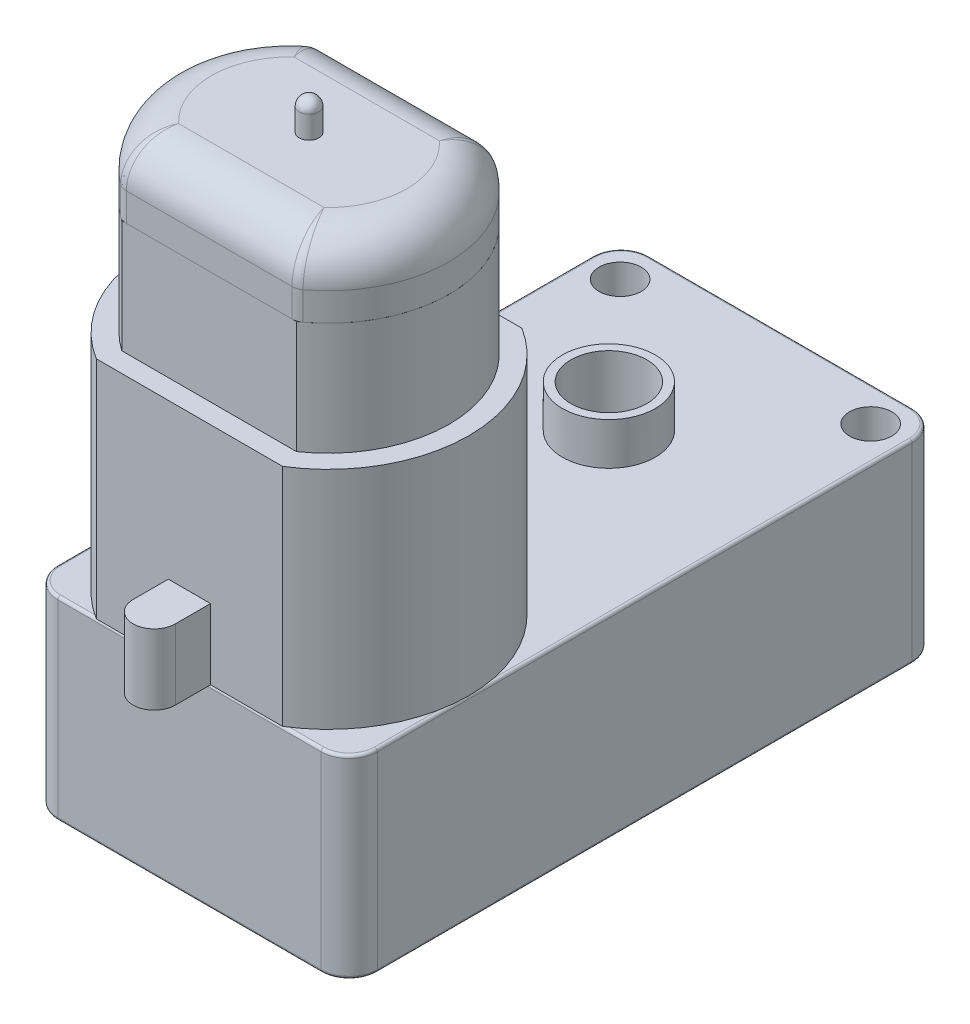
from build123d import *

# Parameters (mm, degrees)
SKETCH1_W           = 22.7
SKETCH1_H           = 42
BOSS_EXTRUDE1_DEPTH = 13.8
BOSS_EXTRUDE2_DEPTH = 16
SKETCH3_R           = 2.7
CUT_EXTRUDE1_DEPTH  = 39.181965638
FILLET1_R           = 2
FILLET2_R           = 0.2
SKETCH4_R           = 1.5
CUT_EXTRUDE2_DEPTH  = 39.181965638
SKETCH5_R           = 3.3
SKETCH5_R_2         = 2.7
BOSS_EXTRUDE3_DEPTH = 3
BOSS_EXTRUDE4_DEPTH = 5
BOSS_EXTRUDE5_DEPTH = 8
BOSS_EXTRUDE6_DEPTH = 5
FILLET3_R           = 3
FILLET4_R           = 1
SKETCH10_R          = 2
BOSS_EXTRUDE7_DEPTH = 2


with BuildPart() as part:
    # Sketch1 → Boss-Extrude1 (new body)
    with BuildSketch(Plane(origin=(0, 0, 0), x_dir=(1, 0, 0), z_dir=(0, 1, 0))):
        Rectangle(SKETCH1_W, SKETCH1_H)
    extrude(amount=BOSS_EXTRUDE1_DEPTH)

    # Sketch3 → Cut-Extrude1 (cut, through all)
    with BuildSketch(Plane.XZ):
        with Locations(Location((0, -8.8, 0), (0, 0, 270))):
            Circle(SKETCH3_R)
    extrude(amount=-CUT_EXTRUDE1_DEPTH, mode=Mode.SUBTRACT)

    # Fillet1
    fillet1_edges = [part.edges().sort_by_distance(p)[0] for p in [
        (11.35, 6.9, 21),
        (-11.35, 6.9, 21),
        (-11.35, 6.9, -21),
        (11.35, 6.9, -21),
    ]]
    fillet(fillet1_edges, radius=FILLET1_R)

    # Fillet2
    fillet2_edges = [part.edges().sort_by_distance(p)[0] for p in [
        (-11.35, 0, 0),
        (-11.35, 13.8, 0),
        (11.35, 0, 0),
        (0, 0, 21),
        (0, 0, -21),
        (10.764213562, 0, -20.414213562),
        (10.764213562, 0, 20.414213562),
        (-10.764213562, 0, 20.414213562),
        (-10.764213562, 0, -20.414213562),
        (0, 13.8, -21),
        (11.35, 13.8, 0),
        (0, 13.8, 21),
        (10.764213562, 13.8, -20.414213562),
        (10.764213562, 13.8, 20.414213562),
        (-10.764213562, 13.8, 20.414213562),
        (-10.764213562, 13.8, -20.414213562),
    ]]
    fillet(fillet2_edges, radius=FILLET2_R)

    # Sketch4 → Cut-Extrude2 (cut, through all)
    with BuildSketch(Plane.XZ):
        with Locations(Location((-8.9, -18.5, 0), (0, 0, 270))):
            Circle(SKETCH4_R)
        with Locations(Location((8.9, -18.5, 0), (0, 0, 270))):
            Circle(SKETCH4_R)
    extrude(amount=-CUT_EXTRUDE2_DEPTH, mode=Mode.SUBTRACT)

    # Sketch5 → Boss-Extrude3 (add)
    with BuildSketch(Plane(origin=(0, 13.8, 0), x_dir=(1, 0, 0), z_dir=(0, 1, 0))):
        with Locations(Location((0, 8.8, 0), (0, 0, 90))):
            Circle(SKETCH5_R)
        with Locations(Location((0, 8.8, 0), (0, 0, 90))):
            Circle(SKETCH5_R_2, mode=Mode.SUBTRACT)
    extrude(amount=BOSS_EXTRUDE3_DEPTH)

    # Sketch10 → Boss-Extrude7 (add)
    with BuildSketch(Plane.XZ):
        with Locations(Location((0, 2.1, 0), (0, 0, 270))):
            Circle(SKETCH10_R)
    extrude(amount=BOSS_EXTRUDE7_DEPTH)


with BuildPart() as body_2:
    # Sketch2 → Boss-Extrude2 (new body)
    with BuildSketch(Plane(origin=(0, 13.8, 0), x_dir=(1, 0, 0), z_dir=(0, 1, 0))):
        with BuildLine():
            Line((-6.617826876, -21), (6.617826876, -21))
            ThreePointArc((6.617826876, -21), (11.35, -12.5), (6.617826876, -4))
            Line((6.617826876, -4), (-6.617826876, -4))
            ThreePointArc((-6.617826876, -4), (-11.35, -12.5), (-6.617826876, -21))
        make_face()
    extrude(amount=BOSS_EXTRUDE2_DEPTH)

    # Sketch6 → Boss-Extrude4 (add)
    with BuildSketch(Plane(origin=(0, 13.8, 0), x_dir=(1, 0, 0), z_dir=(0, 1, 0))):
        with BuildLine():
            Line((-1.5, -21), (-1.5, -23.5))
            ThreePointArc((-1.5, -23.5), (0, -25), (1.5, -23.5))
            Line((1.5, -23.5), (1.5, -21))
            Line((1.5, -21), (-1.5, -21))
        make_face()
        with BuildLine():
            Line((1.5, -4), (-1.5, -4))
            Line((-1.5, -4), (-1.5, -1.5))
            ThreePointArc((-1.5, -1.5), (0, 0), (1.5, -1.5))
            Line((1.5, -1.5), (1.5, -4))
        make_face()
    extrude(amount=BOSS_EXTRUDE4_DEPTH)


with BuildPart() as body_3:
    # Sketch7 → Boss-Extrude5 (new body)
    with BuildSketch(Plane(origin=(0, 29.8, 0), x_dir=(1, 0, 0), z_dir=(0, 1, 0))):
        with BuildLine():
            Line((-6.202834223, -19.6), (6.202834223, -19.6))
            ThreePointArc((6.202834223, -19.6), (9.95, -12.5), (6.202834223, -5.4))
            Line((6.202834223, -5.4), (-6.202834223, -5.4))
            ThreePointArc((-6.202834223, -5.4), (-9.95, -12.5), (-6.202834223, -19.6))
        make_face()
    extrude(amount=BOSS_EXTRUDE5_DEPTH)


with BuildPart() as body_4:
    # Sketch8 → Boss-Extrude6 (new body)
    with BuildSketch(Plane(origin=(0, 37.8, 0), x_dir=(1, 0, 0), z_dir=(0, 1, 0))):
        with BuildLine():
            Line((-6.202834223, -19.6), (6.202834223, -19.6))
            ThreePointArc((6.202834223, -19.6), (9.95, -12.5), (6.202834223, -5.4))
            Line((6.202834223, -5.4), (-6.202834223, -5.4))
            ThreePointArc((-6.202834223, -5.4), (-9.95, -12.5), (-6.202834223, -19.6))
        make_face()
    extrude(amount=BOSS_EXTRUDE6_DEPTH)

    # Fillet3
    # the kernel refuses this fillet: 3 mm, written as the material it takes off along each edge
    with BuildSketch(Plane(origin=(1.35, 42.8, 12.5), x_dir=(-0.26968341341725877, 0, 0.9629490415009592), z_dir=(-0.9629490415009592, 0, -0.26968341341725877))) as fillet3_piece_1:
        with BuildLine():
            CenterArc((8.6 - FILLET3_R, -FILLET3_R), FILLET3_R, 0, 90)
            Line((8.6 - FILLET3_R, 0), (8.6, 0))
            Line((8.6, 0), (8.6, -FILLET3_R))
        make_face()
    revolve(axis=Axis((1.35, 42.8, 12.5), (0, 1, 0)), revolution_arc=211.290857959, mode=Mode.SUBTRACT)
    with BuildSketch(Plane(origin=(13.702834223, 42.8, 5.4), x_dir=(0, -1, 0), z_dir=(-1, 0, 0)), Plane(origin=(-13.702834223, 42.8, 19.6), x_dir=(0, -1, 0), z_dir=(1, 0, 0))) as fillet3_piece_2:
        with BuildLine():
            CenterArc((FILLET3_R, FILLET3_R), FILLET3_R, 180, 90)
            Line((0, FILLET3_R), (0, 0))
            Line((0, 0), (FILLET3_R, 0))
        make_face()
    extrude(amount=27.405668447, mode=Mode.SUBTRACT)
    with BuildSketch(Plane(origin=(-1.35, 42.8, 12.5), x_dir=(0.2696834134172578, 0, -0.9629490415009594), z_dir=(0.9629490415009594, 0, 0.2696834134172578))) as fillet3_piece_3:
        with BuildLine():
            CenterArc((8.6 - FILLET3_R, -FILLET3_R), FILLET3_R, 0, 90)
            Line((8.6 - FILLET3_R, 0), (8.6, 0))
            Line((8.6, 0), (8.6, -FILLET3_R))
        make_face()
    revolve(axis=Axis((-1.35, 42.8, 12.5), (0, 1, 0)), revolution_arc=211.290857959, mode=Mode.SUBTRACT)

    # Fillet4
    fillet4_edges = [body_4.edges().sort_by_distance(p)[0] for p in [
        (-6.202834223, 38.8, 5.4),
        (6.202834223, 38.8, 5.4),
        (6.202834223, 38.8, 19.6),
        (-6.202834223, 38.8, 19.6),
        (5.911819759, 41.955352557, 18.68673317),
        (-5.911819759, 41.955352557, 18.68673317),
        (5.911819759, 41.955352557, 6.31326683),
        (-5.911819759, 41.955352557, 6.31326683),
    ]]
    fillet(fillet4_edges, radius=FILLET4_R)


with BuildPart() as body_5:
    # Sketch9 → Revolve2 (revolve)
    with BuildSketch(Plane(origin=(0, 0, 0), x_dir=(0, 0, -1), z_dir=(1, 0, 0)), mode=Mode.PRIVATE) as revolve2_sk:
        with BuildLine():
            Line((-13.2, 42.8), (-13.2, 44.4))
            ThreePointArc((-13.2, 44.4), (-12.994974747, 44.894974747), (-12.5, 45.1))
            Line((-12.5, 45.1), (-12.5, 42.8))
            Line((-12.5, 42.8), (-13.2, 42.8))
        make_face()
    revolve(revolve2_sk.sketch.rotate(Axis((0, 42.8, 12.5), (0, 1, 0)), 180), axis=Axis((0, 42.8, 12.5), (0, 1, 0)))


solid = Compound([part.part, body_2.part, body_3.part, body_4.part, body_5.part])
